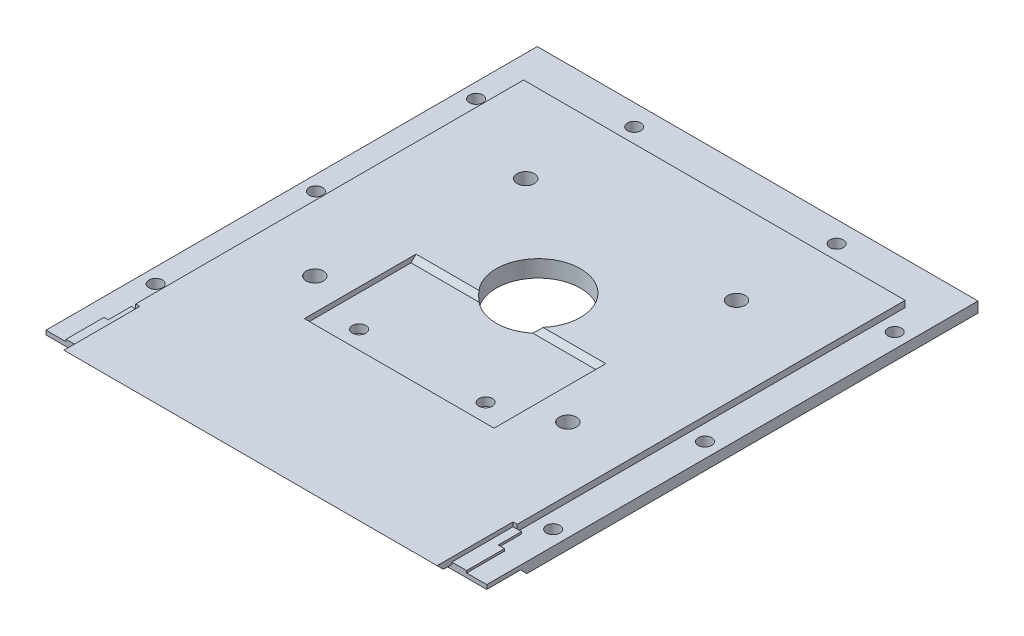
from build123d import *

# Parameters (mm, degrees)
SKETCH_1_W          = 90.5
SKETCH_1_H          = 97
EXTRUDE_1_DEPTH     = 2
SKETCH_2_W          = 104.525
SKETCH_2_H          = 124
SKETCH_2_R          = 1.6
EXTRUDE_2_DEPTH     = 2.5
SKETCH_3_W          = 88.5
SKETCH_3_H          = 17
EXTRUDE_3_DEPTH     = 2
SKETCH_4_W          = 1
SKETCH_4_H          = 5
CUT_EXTRUDE_1_DEPTH = 2
CUT_EXTRUDE_2_DEPTH = 150.601890446
SKETCH_6_W          = 45
SKETCH_6_H          = 25
CUT_EXTRUDE_3_DEPTH = 1.7
CUT_EXTRUDE_4_REACH = 146.972
SKETCH_7_R          = 1.6
CHAMFER_1_SIZE      = 2
CUT_EXTRUDE_5_REACH = 147.014
SKETCH_8_R          = 2.05
CUT_EXTRUDE_6_REACH = 147.014
SKETCH_9_R          = 10
CUT_EXTRUDE_7_DEPTH = 0.8
CUT_EXTRUDE_8_REACH = 151.602
SKETCH_11_W         = 6.5
SKETCH_11_H         = 2.5
CHAMFER_2_SIZE      = 2
SKETCH_12_W         = 104.525
SKETCH_12_H         = 9.5
EXTRUDE_4_DEPTH     = 1
SKETCH_13_W         = 2
SKETCH_13_H         = 14.5
EXTRUDE_5_DEPTH     = 0.5
SKETCH_14_W         = 1.5
SKETCH_14_H         = 9
SKETCH_14_W_2       = 1
EXTRUDE_6_DEPTH     = 0.5
SKETCH_15_W         = 88.5
SKETCH_15_H         = 2.828427125
EXTRUDE_7_DEPTH     = 2
CUT_EXTRUDE_9_DEPTH = 0.5


with BuildPart() as part:
    # 草图1 → 凸台-拉伸1 (new body)
    with BuildSketch(Plane(origin=(0, 0, 0), x_dir=(1, 0, 0), z_dir=(0, 1, 0))):
        with Locations((45.25, 48.5)):
            Rectangle(SKETCH_1_W, SKETCH_1_H)
    extrude(amount=EXTRUDE_1_DEPTH)

    # 草图2 → 凸台-拉伸2 (add)
    with BuildSketch(Plane.XZ):
        with Locations((45.5125, -45)):
            Rectangle(SKETCH_2_W, SKETCH_2_H)
        with Locations(Location((21.25, -102, 0), (0, 0, 270))):
            Circle(SKETCH_2_R, mode=Mode.SUBTRACT)
        with Locations(Location((69.25, -102, 0), (0, 0, 270))):
            Circle(SKETCH_2_R, mode=Mode.SUBTRACT)
        with Locations(Location((-3.25, -89, 0), (0, 0, 270))):
            Circle(SKETCH_2_R, mode=Mode.SUBTRACT)
        with Locations(Location((94.275, -90.75, 0), (0, 0, 270))):
            Circle(SKETCH_2_R, mode=Mode.SUBTRACT)
        with Locations(Location((-3.25, -13, 0), (0, 0, 270))):
            Circle(SKETCH_2_R, mode=Mode.SUBTRACT)
        with Locations(Location((-3.25, -51, 0), (0, 0, 270))):
            Circle(SKETCH_2_R, mode=Mode.SUBTRACT)
        with Locations(Location((94.275, -9.75, 0), (0, 0, 270))):
            Circle(SKETCH_2_R, mode=Mode.SUBTRACT)
        with Locations(Location((94.275, -45.75, 0), (0, 0, 270))):
            Circle(SKETCH_2_R, mode=Mode.SUBTRACT)
    extrude(amount=EXTRUDE_2_DEPTH)

    # 草图3 → 凸台-拉伸3 (add)
    with BuildSketch(Plane(origin=(0, 0, 0), x_dir=(1, 0, 0), z_dir=(0, 1, 0))):
        with Locations((45.25, -8.5)):
            Rectangle(SKETCH_3_W, SKETCH_3_H)
    extrude(amount=EXTRUDE_3_DEPTH)

    # 草图4 → 切除-拉伸1 (cut)
    with BuildSketch(Plane(origin=(0, 0, 0), x_dir=(1, 0, 0), z_dir=(0, 1, 0))):
        with Locations((0.5, 2.5)):
            Rectangle(SKETCH_4_W, SKETCH_4_H)
        with Locations((90, 2.5)):
            Rectangle(SKETCH_4_W, SKETCH_4_H)
    extrude(amount=CUT_EXTRUDE_1_DEPTH, mode=Mode.SUBTRACT)

    # 草图5 → 切除-拉伸2 (cut, through all)
    with BuildSketch(Plane(origin=(97.775, 0, 0), x_dir=(0, 0, -1), z_dir=(1, 0, 0))):
        Polygon((-8.5, -2.5), (-8.5, 0), (-9.5, 0), (-11.5, 2), (-17, 2), (-17, -2.5), align=None)
    extrude(amount=-CUT_EXTRUDE_2_DEPTH, mode=Mode.SUBTRACT)

    # 草图6 → 切除-拉伸3 (cut)
    with BuildSketch(Plane(origin=(0, 2, 0), x_dir=(1, 0, 0), z_dir=(0, 1, 0))):
        with Locations((45.5125, 34.5)):
            Rectangle(SKETCH_6_W, SKETCH_6_H)
    extrude(amount=-CUT_EXTRUDE_3_DEPTH, mode=Mode.SUBTRACT)

    # 草图7 → 切除-拉伸4 (cut, up to next)
    with BuildSketch(Plane(origin=(0, 0.3, 0), x_dir=(1, 0, 0), z_dir=(0, 1, 0)), mode=Mode.PRIVATE) as cut_extrude_4_sk1:
        with Locations(Location((30.5125, 27.5, 0), (0, 0, 270))):
            Circle(SKETCH_7_R)
    cut_extrude_4_tool1 = extrude(cut_extrude_4_sk1.sketch, amount=-CUT_EXTRUDE_4_REACH, mode=Mode.PRIVATE) & part.part
    # 草图7 → 切除-拉伸4 (cut, up to next)
    with BuildSketch(Plane(origin=(0, 0.3, 0), x_dir=(1, 0, 0), z_dir=(0, 1, 0)), mode=Mode.PRIVATE) as cut_extrude_4_sk2:
        with Locations(Location((60.5125, 27.5, 0), (0, 0, 270))):
            Circle(SKETCH_7_R)
    cut_extrude_4_tool2 = extrude(cut_extrude_4_sk2.sketch, amount=-CUT_EXTRUDE_4_REACH, mode=Mode.PRIVATE) & part.part
    add(cut_extrude_4_tool1.solids().sort_by_distance((30.5125, 0.3, -27.5))[0], mode=Mode.SUBTRACT)
    add(cut_extrude_4_tool2.solids().sort_by_distance((60.5125, 0.3, -27.5))[0], mode=Mode.SUBTRACT)

    # 倒角1
    # the kernel refuses this chamfer: 2 mm, written as the material it adds along each edge
    # the kernel refuses this chamfer: 2 mm, written as the material it takes off along each edge
    with BuildSketch(Plane(origin=(23.0125, 2, -47), x_dir=(0, 0.027495876610586296, -0.9996219169112968), z_dir=(1, 0, 0))) as chamfer_1_2_piece_1_section:
        Polygon((CHAMFER_1_SIZE * 0.999621916911, -CHAMFER_1_SIZE * 0.0274958766106), (-CHAMFER_1_SIZE * 0.0274958766106, -CHAMFER_1_SIZE * 0.999621916911), (0, 0), align=None)
    chamfer_1_2_piece_1 = extrude(amount=45, mode=Mode.PRIVATE)
    chamfer_1_2_piece_1 = split(chamfer_1_2_piece_1, bisect_by=Plane(origin=(45.5125, 0.3, -47.679710145), z_dir=(0, 1, 0)), keep=Keep.TOP, mode=Mode.PRIVATE)
    add(chamfer_1_2_piece_1, mode=Mode.SUBTRACT)

    # 草图8 → 切除-拉伸5 (cut, up to next)
    with BuildSketch(Plane(origin=(0, 2, 0), x_dir=(1, 0, 0), z_dir=(0, 1, 0)), mode=Mode.PRIVATE) as cut_extrude_5_sk1:
        with Locations(Location((20.5125, 77, 0), (0, 0, 270))):
            Circle(SKETCH_8_R)
    cut_extrude_5_tool1 = extrude(cut_extrude_5_sk1.sketch, amount=-CUT_EXTRUDE_5_REACH, mode=Mode.PRIVATE) & part.part
    # 草图8 → 切除-拉伸5 (cut, up to next)
    with BuildSketch(Plane(origin=(0, 2, 0), x_dir=(1, 0, 0), z_dir=(0, 1, 0)), mode=Mode.PRIVATE) as cut_extrude_5_sk2:
        with Locations(Location((70.5125, 77, 0), (0, 0, 270))):
            Circle(SKETCH_8_R)
    cut_extrude_5_tool2 = extrude(cut_extrude_5_sk2.sketch, amount=-CUT_EXTRUDE_5_REACH, mode=Mode.PRIVATE) & part.part
    # 草图8 → 切除-拉伸5 (cut, up to next)
    with BuildSketch(Plane(origin=(0, 2, 0), x_dir=(1, 0, 0), z_dir=(0, 1, 0)), mode=Mode.PRIVATE) as cut_extrude_5_sk3:
        with Locations(Location((15.5125, 32, 0), (0, 0, 270))):
            Circle(SKETCH_8_R)
    cut_extrude_5_tool3 = extrude(cut_extrude_5_sk3.sketch, amount=-CUT_EXTRUDE_5_REACH, mode=Mode.PRIVATE) & part.part
    # 草图8 → 切除-拉伸5 (cut, up to next)
    with BuildSketch(Plane(origin=(0, 2, 0), x_dir=(1, 0, 0), z_dir=(0, 1, 0)), mode=Mode.PRIVATE) as cut_extrude_5_sk4:
        with Locations(Location((75.5125, 32, 0), (0, 0, 270))):
            Circle(SKETCH_8_R)
    cut_extrude_5_tool4 = extrude(cut_extrude_5_sk4.sketch, amount=-CUT_EXTRUDE_5_REACH, mode=Mode.PRIVATE) & part.part
    add(cut_extrude_5_tool1.solids().sort_by_distance((20.5125, 2, -77))[0], mode=Mode.SUBTRACT)
    add(cut_extrude_5_tool2.solids().sort_by_distance((70.5125, 2, -77))[0], mode=Mode.SUBTRACT)
    add(cut_extrude_5_tool3.solids().sort_by_distance((15.5125, 2, -32))[0], mode=Mode.SUBTRACT)
    add(cut_extrude_5_tool4.solids().sort_by_distance((75.5125, 2, -32))[0], mode=Mode.SUBTRACT)

    # 草图9 → 切除-拉伸6 (cut, up to next)
    with BuildSketch(Plane(origin=(0, 2, 0), x_dir=(1, 0, 0), z_dir=(0, 1, 0)), mode=Mode.PRIVATE) as cut_extrude_6_sk1:
        with Locations(Location((45.5125, 55, 0), (0, 0, 230.353888853))):
            Circle(SKETCH_9_R)
    cut_extrude_6_tool1 = extrude(cut_extrude_6_sk1.sketch, amount=-CUT_EXTRUDE_6_REACH, mode=Mode.PRIVATE) & part.part
    add(cut_extrude_6_tool1.solids().sort_by_distance((45.5125, 2, -55))[0], mode=Mode.SUBTRACT)

    # 草图10 → 切除-拉伸7 (cut)
    with BuildSketch(Plane.XZ.offset(2.5)):
        Polygon((27.7625, -25.91228676), (27.7625, -29.08771324), (30.5125, -30.675426481), (33.2625, -29.08771324), (33.2625, -25.91228676), (30.5125, -24.324573519), align=None)
        Polygon((57.7625, -25.91228676), (57.7625, -29.08771324), (60.5125, -30.675426481), (63.2625, -29.08771324), (63.2625, -25.91228676), (60.5125, -24.324573519), align=None)
    extrude(amount=-CUT_EXTRUDE_7_DEPTH, mode=Mode.SUBTRACT)

    # 草图11 → 切除-拉伸8 (cut, up to next)
    with BuildSketch(Plane(origin=(97.775, 0, 0), x_dir=(0, 0, -1), z_dir=(1, 0, 0)), mode=Mode.PRIVATE) as cut_extrude_8_sk1:
        with Locations((-5.25, -1.25)):
            Rectangle(SKETCH_11_W, SKETCH_11_H)
    cut_extrude_8_tool1 = extrude(cut_extrude_8_sk1.sketch, amount=-CUT_EXTRUDE_8_REACH, mode=Mode.PRIVATE) & part.part
    add(cut_extrude_8_tool1.solids().sort_by_distance((97.775, -1.25, 5.25))[0], mode=Mode.SUBTRACT)

    # 倒角2
    chamfer_2_edges = [part.edges().sort_by_distance(p)[0] for p in [
        (45.5125, -2.5, 2),
    ]]
    chamfer(chamfer_2_edges, length=CHAMFER_2_SIZE)

    # 草图12 → 凸台-拉伸4 (add)
    with BuildSketch(Plane.XZ):
        with Locations((45.5125, 4.75)):
            Rectangle(SKETCH_12_W, SKETCH_12_H)
    extrude(amount=EXTRUDE_4_DEPTH)

    # 草图13 → 凸台-拉伸5 (add)
    with BuildSketch(Plane(origin=(0, 0, 0), x_dir=(1, 0, 0), z_dir=(0, 1, 0))):
        with Locations((0, -2.25)):
            Rectangle(SKETCH_13_W, SKETCH_13_H)
        with Locations((90.5, -2.25)):
            Rectangle(SKETCH_13_W, SKETCH_13_H)
    extrude(amount=EXTRUDE_5_DEPTH)

    # 草图14 → 凸台-拉伸6 (add)
    with BuildSketch(Plane(origin=(0, 0, 0), x_dir=(1, 0, 0), z_dir=(0, 1, 0))):
        with Locations((92.25, -5)):
            Rectangle(SKETCH_14_W, SKETCH_14_H)
        with Locations((-1.5, -5)):
            Rectangle(SKETCH_14_W_2, SKETCH_14_H)
    extrude(amount=EXTRUDE_6_DEPTH)

    # 草图15 → 凸台-拉伸7 (add, along a direction that is not the sketch's normal)
    with BuildSketch(Plane(origin=(0, -4.75, 4.75), x_dir=(1, 0, 0), z_dir=(0, -0.7071067811865501, 0.7071067811865449))):
        with Locations((45.25, 8.131727983)):
            Rectangle(SKETCH_15_W, SKETCH_15_H)
    extrude(amount=EXTRUDE_7_DEPTH, dir=(0, 0, 1))

    # 草图16 → 切除-拉伸9 (cut)
    with BuildSketch(Plane(origin=(0, 2, 0), x_dir=(1, 0, 0), z_dir=(0, 1, 0))):
        Polygon((1, 5), (1, -13.5), (89.5, -13.5), (89.5, 5), (90.5, 5), (90.5, 97), (0, 97), (0, 5), align=None)
    extrude(amount=-CUT_EXTRUDE_9_DEPTH, mode=Mode.SUBTRACT)


solid = part.part
